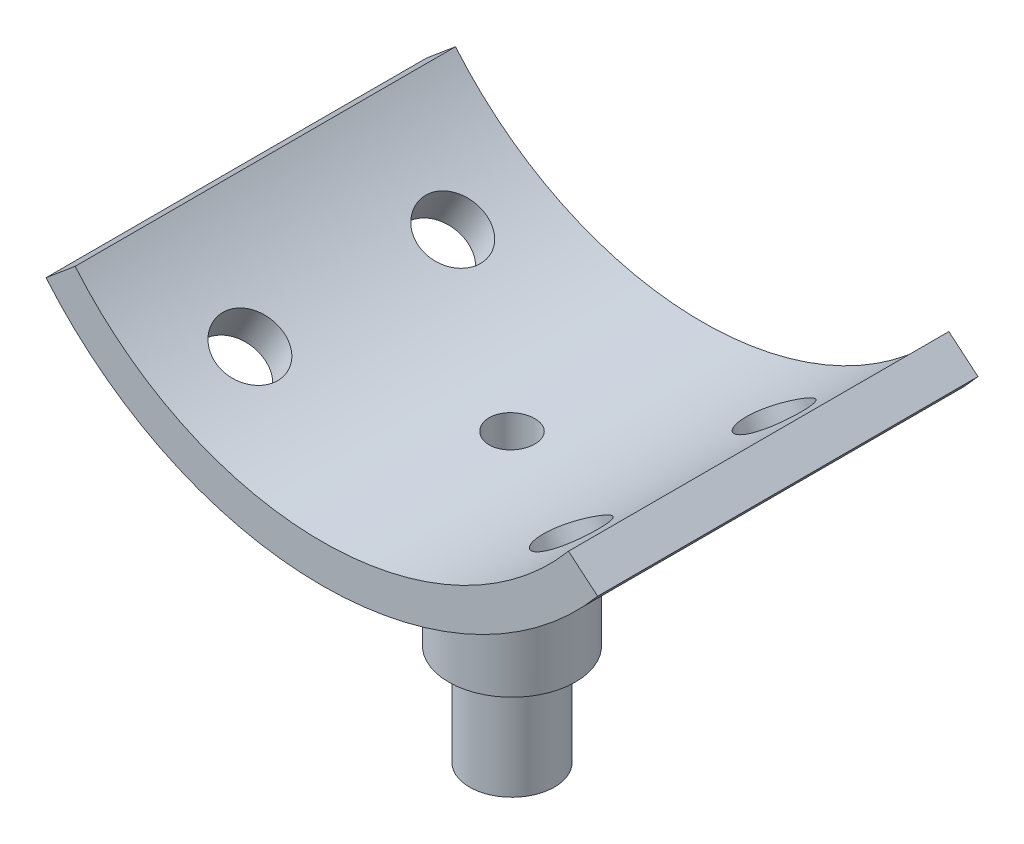
from build123d import *

# Parameters (mm, degrees)
BOSS_EXTRUDE1_DEPTH      = 15
BOSS_EXTRUDE2_REACH      = 37.479
BOSS_EXTRUDE2_END_RADIUS = 28.4
SKETCH2_R                = 5
SKETCH13_R               = 2.5
CUT_EXTRUDE2_DEPTH       = 42.894151609
SKETCH14_R               = 3.35
BOSS_EXTRUDE4_DEPTH      = 8
SKETCH15_R               = 1.8
CUT_EXTRUDE3_DEPTH       = 42.249243801


with BuildPart() as part:
    # Sketch1 → Boss-Extrude1 (new, symmetric)
    with BuildSketch(Plane.XY):
        with BuildLine():
            Line((21.755662185, -18.255168115), (19.457528855, -16.326805286))
            ThreePointArc((19.457528855, -16.326805286), (0, -25.4), (-19.457528855, -16.326805286))
            Line((-19.457528855, -16.326805286), (-21.755662185, -18.255168115))
            ThreePointArc((-21.755662185, -18.255168115), (0, -28.4), (21.755662185, -18.255168115))
        make_face()
    extrude(amount=BOSS_EXTRUDE1_DEPTH, both=True)

    # Boss-Extrude2: up to this cylinder (the profile starts outside it)
    boss_extrude2_end = Plane(origin=(0, 0, 0), z_dir=(0, 0, -1)) * Cylinder(BOSS_EXTRUDE2_END_RADIUS, 132.758, mode=Mode.PRIVATE)
    # Sketch2 → Boss-Extrude2 (add, up to the surface)
    with BuildSketch(Plane(origin=(0, -40, 0), x_dir=(1, 0, 0), z_dir=(0, 1, 0)), mode=Mode.PRIVATE) as boss_extrude2_sk1:
        Circle(SKETCH2_R)
    boss_extrude2_tool1 = extrude(boss_extrude2_sk1.sketch, amount=BOSS_EXTRUDE2_REACH, mode=Mode.PRIVATE) - boss_extrude2_end
    add(boss_extrude2_tool1.solids().sort_by_distance((0, -40, 0))[0])

    # Sketch13 → Cut-Extrude2 (cut, through all)
    with BuildSketch(Plane(origin=(14.2, -24.595121467, 0), x_dir=(-0.8660254037844379, -0.5000000000000014, 0), z_dir=(0.5000000000000014, -0.8660254037844379, 0))):
        with Locations((0, 8)):
            Circle(SKETCH13_R)
        with Locations((0, -8)):
            Circle(SKETCH13_R)
    cut_extrude2 = extrude(amount=-CUT_EXTRUDE2_DEPTH, mode=Mode.SUBTRACT)

    # Mirror1: Cut-Extrude2 across plane
    add(cut_extrude2.mirror(Plane(origin=(0, 0, 0), x_dir=(0, 0, 1), z_dir=(1, 0, 0))), mode=Mode.SUBTRACT)

    # Sketch14 → Boss-Extrude4 (add)
    with BuildSketch(Plane.XZ.offset(40)):
        Circle(SKETCH14_R)
    extrude(amount=BOSS_EXTRUDE4_DEPTH)

    # Sketch15 → Cut-Extrude3 (cut, through all)
    with BuildSketch(Plane.XZ.offset(48)):
        Circle(SKETCH15_R)
    extrude(amount=-CUT_EXTRUDE3_DEPTH, mode=Mode.SUBTRACT)


solid = part.part
